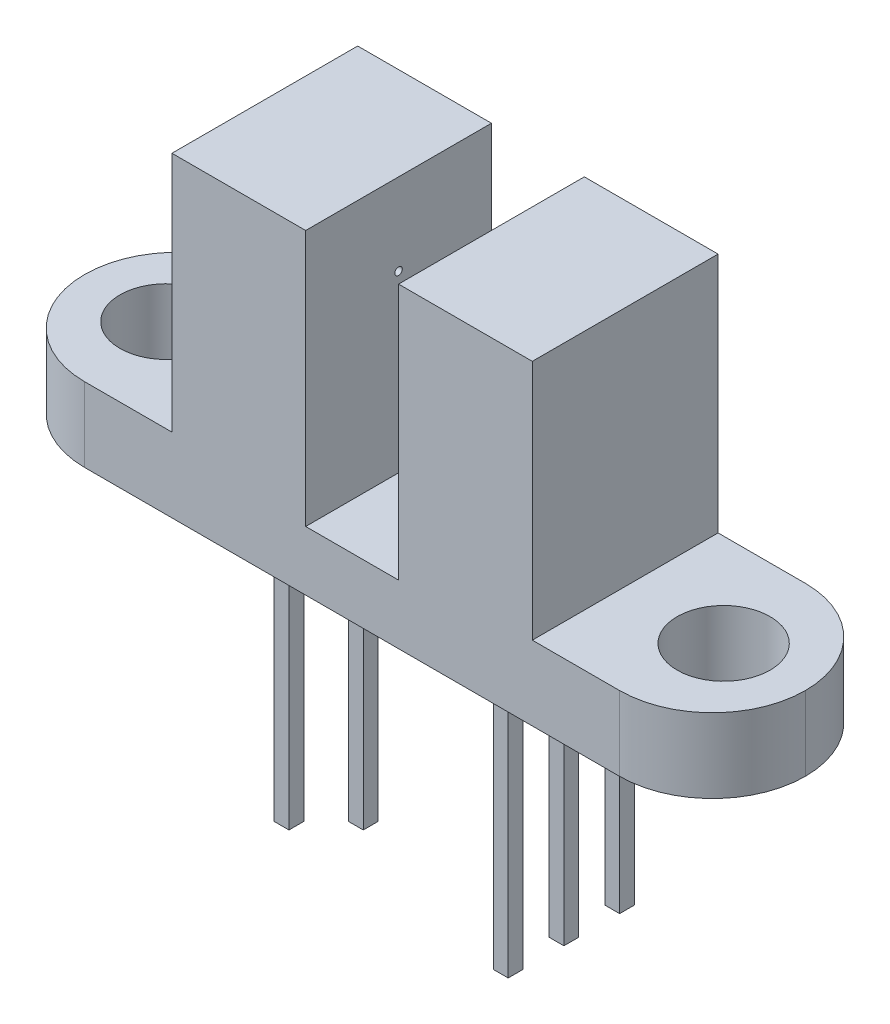
from build123d import *

# Parameters (mm, degrees)
BOSS_EXTRUDE1_DEPTH = 3.175
FILLET1_R           = 3.175
SKETCH2_R           = 1.5875
CUT_EXTRUDE1_DEPTH  = 16.165203955
SKETCH3_R           = 0.127
CUT_EXTRUDE2_DEPTH  = 0.254
CUT_EXTRUDE3_START  = -0.254
SKETCH4_R           = 0.127
CUT_EXTRUDE3_DEPTH  = 0.254
SKETCH5_W           = 0.508
SKETCH5_H           = 0.508
BOSS_EXTRUDE2_DEPTH = 8.89
SKETCH6_W           = 0.508
SKETCH6_H           = 0.508
BOSS_EXTRUDE3_DEPTH = 1.27


with BuildPart() as part:
    # Sketch1 → Boss-Extrude1 (new, symmetric)
    with BuildSketch(Plane.XY):
        Polygon((12.319, 0), (-12.319, 0), (-12.319, 2.54), (-6.1595, 2.54), (-6.1595, 10.795), (-1.5875, 10.795), (-1.5875, 2.032), (1.5875, 2.032), (1.5875, 10.795), (6.1595, 10.795), (6.1595, 2.54), (12.319, 2.54), align=None)
    extrude(amount=BOSS_EXTRUDE1_DEPTH, both=True)

    # Fillet1
    fillet1_edges = [part.edges().sort_by_distance(p)[0] for p in [
        (-12.319, 1.27, 3.175),
        (-12.319, 1.27, -3.175),
        (12.319, 1.27, -3.175),
        (12.319, 1.27, 3.175),
    ]]
    fillet(fillet1_edges, radius=FILLET1_R - 0.0001)  # a hair under: the kernel refuses the full size

    # Sketch2 → Cut-Extrude1 (cut, through all)
    with BuildSketch(Plane(origin=(0, 2.54, 0), x_dir=(1, 0, 0), z_dir=(0, 1, 0))):
        with Locations(Location((-9.525, 0, 0), (0, 0, 270))):
            Circle(SKETCH2_R)
        with Locations(Location((9.525, 0, 0), (0, 0, 270))):
            Circle(SKETCH2_R)
    extrude(amount=-CUT_EXTRUDE1_DEPTH, mode=Mode.SUBTRACT)

    # Sketch3 → Cut-Extrude2 (cut)
    with BuildSketch(Plane.ZY.offset(-1.5875)):
        with Locations(Location((0, 8.001, 0), (0, 0, 270))):
            Circle(SKETCH3_R)
    extrude(amount=-CUT_EXTRUDE2_DEPTH, mode=Mode.SUBTRACT)

    # Sketch4 → Cut-Extrude3 (cut)
    with BuildSketch(Plane(origin=(-1.5875, 0, 0), x_dir=(0, 0, -1), z_dir=(1, 0, 0)).offset(CUT_EXTRUDE3_START)):
        with Locations(Location((0, 8.001, 0), (0, 0, 270))):
            Circle(SKETCH4_R)
    extrude(amount=CUT_EXTRUDE3_DEPTH, mode=Mode.SUBTRACT)

    # Sketch5 → Boss-Extrude2 (add)
    with BuildSketch(Plane.XZ):
        with Locations((-4.064, 1.27)):
            Rectangle(SKETCH5_W, SKETCH5_H)
        with Locations((-4.064, -1.27)):
            Rectangle(SKETCH5_W, SKETCH5_H)
        with Locations((4.064, 1.905)):
            Rectangle(SKETCH5_W, SKETCH5_H)
        with Locations((4.064, 0)):
            Rectangle(SKETCH5_W, SKETCH5_H)
        with Locations((4.064, -1.905)):
            Rectangle(SKETCH5_W, SKETCH5_H)
    extrude(amount=BOSS_EXTRUDE2_DEPTH)

    # Sketch6 → Boss-Extrude3 (add)
    with BuildSketch(Plane.XZ.offset(8.89)):
        with Locations((-4.064, -1.27)):
            Rectangle(SKETCH6_W, SKETCH6_H)
    extrude(amount=BOSS_EXTRUDE3_DEPTH)


solid = part.part
